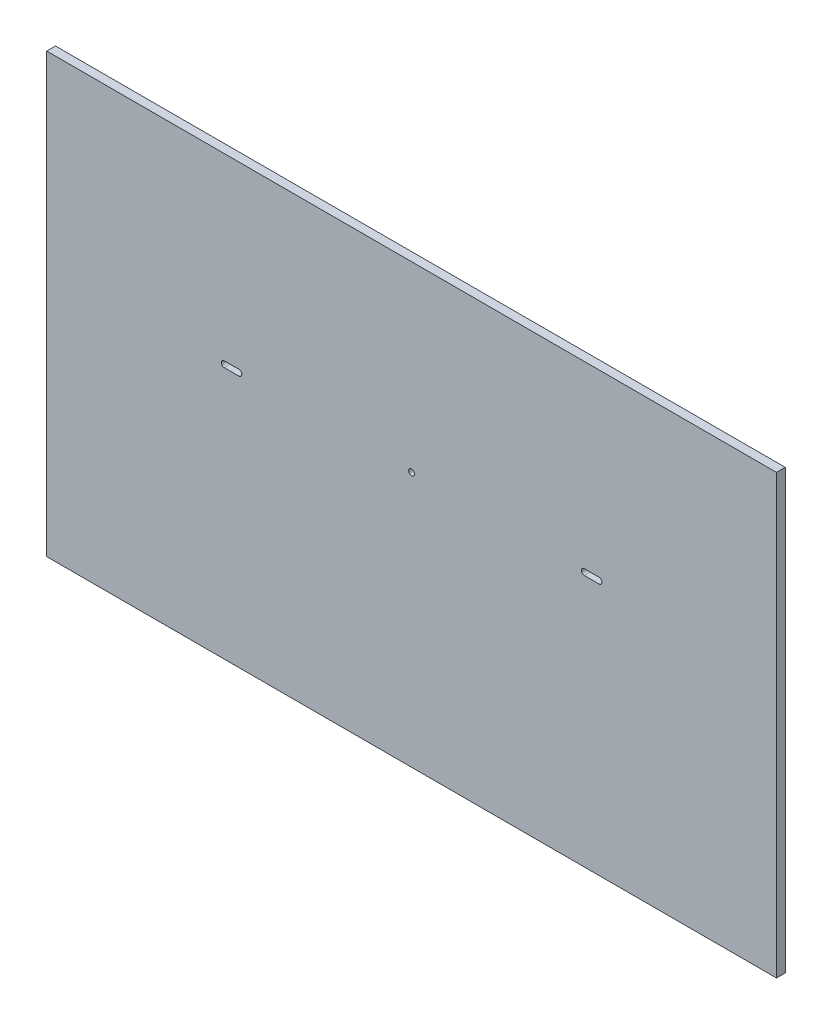
from build123d import *

# Parameters (mm, degrees)
SKETCH1_W           = 1000
SKETCH1_H           = 600
BOSS_EXTRUDE1_DEPTH = 12
SKETCH2_R           = 4.05
CUT_EXTRUDE1_DEPTH  = 584.218655394


with BuildPart() as part:
    # Sketch1 → Boss-Extrude1 (new body)
    with BuildSketch(Plane.XY):
        Rectangle(SKETCH1_W, SKETCH1_H)
    extrude(amount=BOSS_EXTRUDE1_DEPTH)

    # Sketch2 → Cut-Extrude1 (cut, through all)
    with BuildSketch(Plane.XY.offset(12)):
        with Locations((0, 50)):
            Circle(SKETCH2_R)
        with BuildLine():
            Line((-256.731, 54.05), (-236.731, 54.05))
            ThreePointArc((-236.731, 54.05), (-232.681, 50), (-236.731, 45.95))
            Line((-236.731, 45.95), (-256.731, 45.95))
            ThreePointArc((-256.731, 45.95), (-260.781, 50), (-256.731, 54.05))
        make_face()
        with BuildLine():
            Line((256.731, 54.05), (236.731, 54.05))
            ThreePointArc((236.731, 54.05), (232.681, 50), (236.731, 45.95))
            Line((236.731, 45.95), (256.731, 45.95))
            ThreePointArc((256.731, 45.95), (260.781, 50), (256.731, 54.05))
        make_face()
    extrude(amount=-CUT_EXTRUDE1_DEPTH, mode=Mode.SUBTRACT)


solid = part.part
